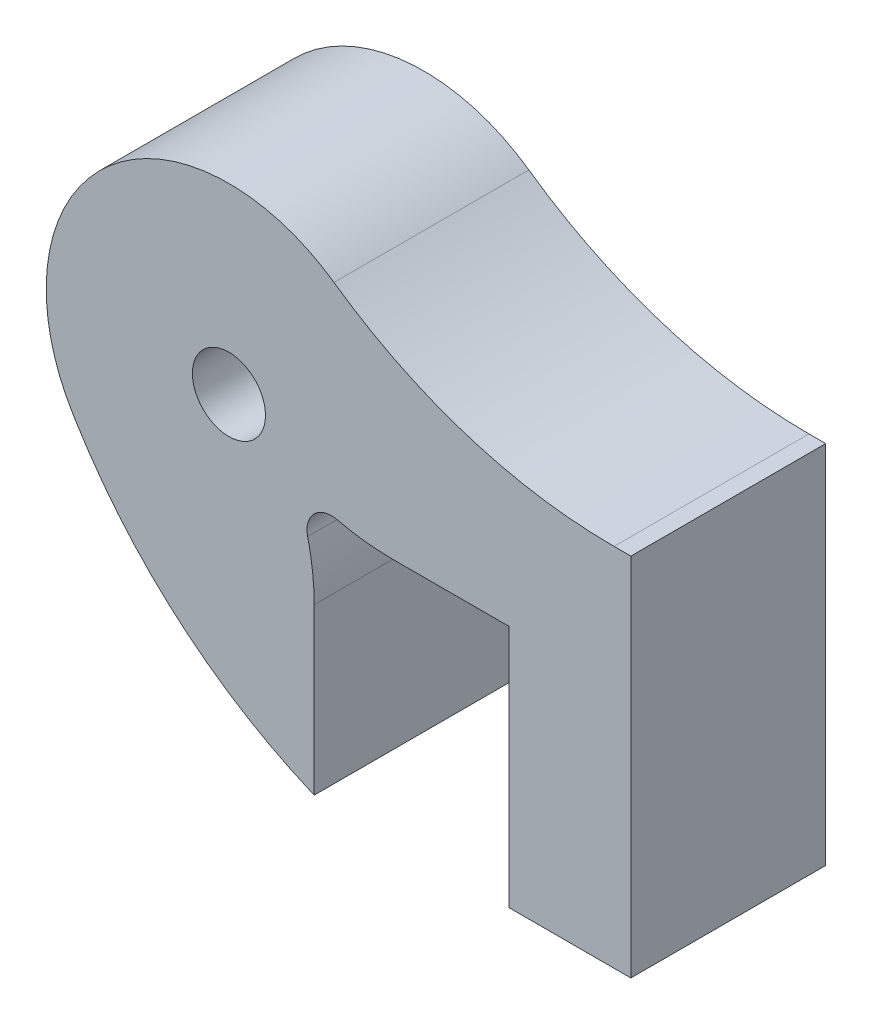
from build123d import *

# Parameters (mm, degrees)
SKETCH1_R           = 1.5
BOSS_EXTRUDE1_DEPTH = 8
SKETCH2_R           = 1
CUT_EXTRUDE1_DEPTH  = 27.248809497
FILLET1_R           = 10
BOSS_EXTRUDE2_DEPTH = 8
FILLET2_R           = 20
FILLET3_R           = 21


with BuildPart() as part:
    # Sketch1 → Boss-Extrude1 (new body)
    with BuildSketch(Plane.XY):
        Polygon((20, 0), (15, 0), (15, 10), (7, 10), (7, 0), (0, 0), (0, 15), (20, 15), align=None)
        with Locations((3.5, 12.5)):
            Circle(SKETCH1_R, mode=Mode.SUBTRACT)
    extrude(amount=BOSS_EXTRUDE1_DEPTH)

    # Sketch2 → Cut-Extrude1 (cut, through all)
    with BuildSketch(Plane.XY.offset(8)):
        with Locations((7.707106781, 9.292893219)):
            Circle(SKETCH2_R)
    extrude(amount=-CUT_EXTRUDE1_DEPTH, mode=Mode.SUBTRACT)

    # Fillet1
    fillet1_edges = [part.edges().sort_by_distance(p)[0] for p in [
        (8.414213562, 10, 4),
        (7, 8.585786438, 4),
    ]]
    fillet(fillet1_edges, radius=FILLET1_R)

    # Sketch3 → Boss-Extrude2 (add)
    with BuildSketch(Plane.XY.offset(8)):
        with BuildLine():
            Line((0, 15), (10.571067812, 15))
            ThreePointArc((10.571067812, 15), (-1.403283931, 18.175192217), (0, 5.866750419))
            Line((0, 5.866750419), (0, 15))
        make_face()
    extrude(amount=-BOSS_EXTRUDE2_DEPTH)

    # Fillet2
    # the kernel refuses this fillet: 20 mm, written as the material it adds along each edge
    with BuildSketch(Plane(origin=(10.571067812, 15, 8), x_dir=(1, 0, 0), z_dir=(0, 0, -1))) as fillet2_piece_1:
        with BuildLine():
            CenterArc((8.740320489, -20), FILLET2_R, 90, 35.096801228)
            Line((-2.758871003, -3.636363636), (-2.988854832, -3.309090909))
            ThreePointArc((-2.988854832, -3.309090909), (-1.414747274, -1.791391146), (-0.377123617, 0.133333333))
            Line((-0.377123617, 0.133333333), (0, 0.4))
            Line((0, 0.4), (8.740320489, 0.4))
            Line((8.740320489, 0.4), (8.740320489, 0))
        make_face()
    extrude(amount=8)
    with BuildSketch(Plane(origin=(0, 5.866750419, 8), x_dir=(0, -1, 0), z_dir=(0, 0, -1))) as fillet2_piece_2:
        with BuildLine():
            CenterArc((7.803057197, 19.906047223), FILLET2_R, 238.334677688, 26.109509541)
            Line((-2.696075005, 2.883467425), (-2.906057649, 2.543015829))
            ThreePointArc((-2.906057649, 2.543015829), (-1.447100359, 1.349108809), (-0.353773311, -0.186666667))
            Line((-0.353773311, -0.186666667), (0, -0.4))
            ThreePointArc((0, -0.4), (2.93337521, -0.4), (5.828024284, -0.398120944))
            Line((5.828024284, -0.398120944), (5.866750419, 0))
        make_face()
    extrude(amount=8)

    # Fillet3
    # the kernel refuses this fillet: 21 mm, written as the material it takes off along each edge
    with BuildSketch(Plane(origin=(0, 0, -22.27715114), x_dir=(-0.3161074470851615, 0.9487233958838066, 0), z_dir=(0, 0, 1))) as fillet3_piece_1:
        with BuildLine():
            CenterArc((13.589062195, -20.472284398), FILLET3_R, 102.871869537, 35.932692131)
            Line((-2.21275213, -6.641063771), (-2.528788416, -6.364439359))
            ThreePointArc((-2.528788416, -6.364439359), (-1.504839891, -3.187766758), (-0.398463826, 0.132765128))
            Line((-0.398463826, 0.132765128), (0.093564035, 0.409445688))
            ThreePointArc((0.093564035, 0.409445688), (4.455430228, -0.082586287), (8.817296421, 0.409445688))
            Line((8.817296421, 0.409445688), (8.910860456, 0))
        make_face()
    extrude(amount=52.55430228, mode=Mode.SUBTRACT)


solid = part.part
